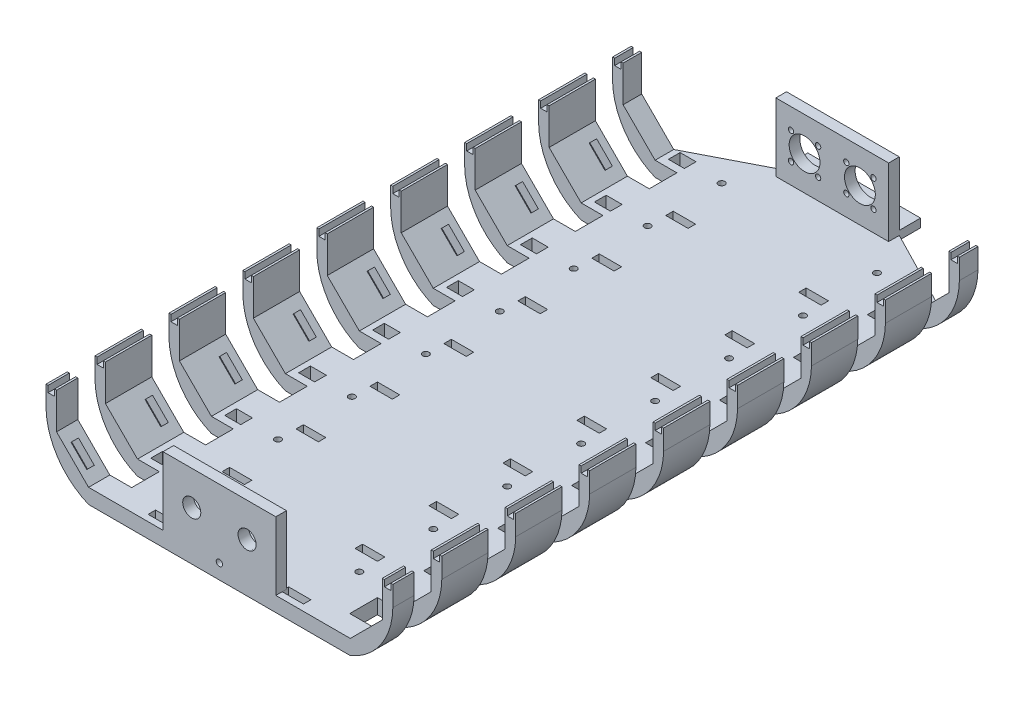
from build123d import *

# Parameters (mm, degrees)
BOSS_EXTRUDE1_DEPTH      = 7
SKETCH2_W                = 123
SKETCH2_H                = 5
BOSS_EXTRUDE2_DEPTH      = 32
SKETCH9_W                = 123
SKETCH9_H                = 7
BOSS_EXTRUDE4_DEPTH      = 5
SKETCH13_W               = 35
SKETCH13_H               = 32
CUT_EXTRUDE5_DEPTH       = 11
BOSS_EXTRUDE10_DEPTH     = 275
BOSS_EXTRUDE13_DEPTH     = 7
SKETCH18_W               = 53
SKETCH18_H               = 5
BOSS_EXTRUDE14_DEPTH     = 32
SKETCH3_R                = 4.25
CUT_EXTRUDE8_DEPTH       = 334
SKETCH19_R               = 7.25
SKETCH19_R_2             = 1.25
CUT_EXTRUDE9_DEPTH       = 334
CUT_EXTRUDE13_DEPTH      = 19
CUT_EXTRUDE16_DEPTH      = 181.638451056
CUT_EXTRUDE16_DEPTH_BACK = 181.638451056
SKETCH32_R               = 1.5
SKETCH32_W               = 30.25
SKETCH32_H               = 13
SKETCH32_W_2             = 7.5
SKETCH32_H_2             = 5.5
SKETCH33_W               = 10.5
SKETCH33_H               = 3.5
CUT_EXTRUDE18_DEPTH      = 4.5
SKETCH34_W               = 3.5
SKETCH34_H               = 10.5
CUT_EXTRUDE19_DEPTH      = 4.5
SKETCH35_W               = 3
SKETCH35_H               = 275
CUT_EXTRUDE20_DEPTH      = 3
SKETCH36_W               = 53
SKETCH36_H               = 4
BOSS_EXTRUDE15_DEPTH     = 10
SKETCH37_R               = 1.5
CUT_EXTRUDE21_DEPTH      = 10
DRAFT1_ANGLE             = 1


with BuildPart() as part:
    # Sketch1 → Boss-Extrude1 (new body)
    with BuildSketch(Plane(origin=(0, 0, 0), x_dir=(1, 0, 0), z_dir=(0, 1, 0))):
        Polygon((-13, 135), (-36, 135), (-61.5, 135), (-61.5, -135), (-36, -135), (-13, -135), (13, -135), (36, -135), (61.5, -135), (61.5, 135), (36, 135), (13, 135), align=None)
    extrude(amount=BOSS_EXTRUDE1_DEPTH)

    # Sketch2 → Boss-Extrude2 (add)
    with BuildSketch(Plane(origin=(0, 7, 0), x_dir=(1, 0, 0), z_dir=(0, 1, 0))):
        with Locations((0, -132.5)):
            Rectangle(SKETCH2_W, SKETCH2_H)
    extrude(amount=BOSS_EXTRUDE2_DEPTH)

    # Sketch9 → Boss-Extrude4 (add)
    with BuildSketch(Plane(origin=(0, 0, -135), x_dir=(-1, 0, 0), z_dir=(0, 0, -1))):
        with Locations((0, 3.5)):
            Rectangle(SKETCH9_W, SKETCH9_H)
    extrude(amount=BOSS_EXTRUDE4_DEPTH)

    # Sketch13 → Cut-Extrude5 (cut)
    with BuildSketch(Plane.XY.offset(135)):
        with Locations((-44, 23)):
            Rectangle(SKETCH13_W, SKETCH13_H)
        with Locations((44, 23)):
            Rectangle(SKETCH13_W, SKETCH13_H)
    extrude(amount=-CUT_EXTRUDE5_DEPTH, mode=Mode.SUBTRACT)

    # Sketch14 → Boss-Extrude10 (add)
    with BuildSketch(Plane.XY.offset(135)):
        with BuildLine():
            Line((-76.55, 22.05), (-61.5, 7))
            Line((-61.5, 7), (-61.5, 0))
            ThreePointArc((-61.5, 0), (-75.904786932, 11.763703775), (-81.5, 29.5))
            Line((-81.5, 29.5), (-81.5, 39))
            Line((-81.5, 39), (-76.55, 39))
            Line((-76.55, 39), (-76.55, 22.05))
        make_face()
        with BuildLine():
            Line((81.5, 39), (76.55, 39))
            Line((76.55, 39), (76.55, 22.05))
            Line((76.55, 22.05), (61.5, 7))
            Line((61.5, 7), (61.5, 0))
            ThreePointArc((61.5, 0), (75.904786932, 11.763703775), (81.5, 29.5))
            Line((81.5, 29.5), (81.5, 39))
        make_face()
    extrude(amount=-BOSS_EXTRUDE10_DEPTH)

    # Sketch17 → Boss-Extrude13 (add)
    with BuildSketch(Plane(origin=(0, 7, 0), x_dir=(1, 0, 0), z_dir=(0, 1, 0))):
        Polygon((-61.5, 140), (-26.5, 226), (0, 226), (26.5, 226), (61.5, 140), align=None)
    extrude(amount=-BOSS_EXTRUDE13_DEPTH)

    # Sketch18 → Boss-Extrude14 (add)
    with BuildSketch(Plane(origin=(0, 7, 0), x_dir=(1, 0, 0), z_dir=(0, 1, 0))):
        with Locations((0, 155.5)):
            Rectangle(SKETCH18_W, SKETCH18_H)
    extrude(amount=BOSS_EXTRUDE14_DEPTH)

    # Sketch3 → Cut-Extrude8 (cut)
    with BuildSketch(Plane.XY.offset(135)):
        with Locations((-13, 23)):
            Circle(SKETCH3_R)
        with Locations((13, 23)):
            Circle(SKETCH3_R)
    extrude(amount=-CUT_EXTRUDE8_DEPTH, mode=Mode.SUBTRACT)

    # Sketch19 → Cut-Extrude9 (cut)
    with BuildSketch(Plane.XY.offset(-153)):
        with Locations((-13, 23)):
            Circle(SKETCH19_R)
        with Locations((-6.636038969, 16.636038969)):
            Circle(SKETCH19_R_2)
        with Locations((-6.636038969, 29.363961031)):
            Circle(SKETCH19_R_2)
        with Locations((-19.363961031, 29.363961031)):
            Circle(SKETCH19_R_2)
        with Locations((-19.363961031, 16.636038969)):
            Circle(SKETCH19_R_2)
        with Locations((13, 23)):
            Circle(SKETCH19_R)
        with Locations((19.363961031, 16.636038969)):
            Circle(SKETCH19_R_2)
        with Locations((6.636038969, 16.636038969)):
            Circle(SKETCH19_R_2)
        with Locations((6.636038969, 29.363961031)):
            Circle(SKETCH19_R_2)
        with Locations((19.363961031, 29.363961031)):
            Circle(SKETCH19_R_2)
    extrude(amount=-CUT_EXTRUDE9_DEPTH, mode=Mode.SUBTRACT)

    # Sketch29 → Cut-Extrude13 (cut)
    with BuildSketch(Plane(origin=(0, 7, 0), x_dir=(1, 0, 0), z_dir=(0, 1, 0))):
        Polygon((-61.5, 140), (-26.5, 158), (26.5, 158), (61.5, 140), (26.5, 226), (-26.5, 226), align=None)
    extrude(amount=-CUT_EXTRUDE13_DEPTH, mode=Mode.SUBTRACT)

    # Sketch32 → Cut-Extrude16 (cut, two sides: drawn at the far end of the back side and taken through both)
    with BuildSketch(Plane(origin=(0, 7, 0), x_dir=(1, 0, 0), z_dir=(0, 1, 0)).offset(-CUT_EXTRUDE16_DEPTH_BACK)):
        with Locations((-36.5, 137.5)):
            Circle(SKETCH32_R)
        with Locations((-36.5, 102.75)):
            Circle(SKETCH32_R)
        with Locations((-36.5, 68)):
            Circle(SKETCH32_R)
        with Locations((-36.5, 33.25)):
            Circle(SKETCH32_R)
        with Locations((-36.5, -1.5)):
            Circle(SKETCH32_R)
        with Locations((-36.5, -36.25)):
            Circle(SKETCH32_R)
        with Locations((-36.5, -71)):
            Circle(SKETCH32_R)
        with Locations((-36.5, -105.75)):
            Circle(SKETCH32_R)
        with Locations((36.5, -105.75)):
            Circle(SKETCH32_R)
        with Locations((36.5, -71)):
            Circle(SKETCH32_R)
        with Locations((36.5, -36.25)):
            Circle(SKETCH32_R)
        with Locations((36.5, -1.5)):
            Circle(SKETCH32_R)
        with Locations((36.5, 33.25)):
            Circle(SKETCH32_R)
        with Locations((36.5, 68)):
            Circle(SKETCH32_R)
        with Locations((36.5, 102.75)):
            Circle(SKETCH32_R)
        with Locations((36.5, 137.5)):
            Circle(SKETCH32_R)
        with Locations((-66.375, 124.75)):
            Rectangle(SKETCH32_W, SKETCH32_H)
        with Locations((-55, 137.5)):
            Rectangle(SKETCH32_W_2, SKETCH32_H_2)
        with Locations((-66.375, 90)):
            Rectangle(SKETCH32_W, SKETCH32_H)
        with Locations((-55, 102.75)):
            Rectangle(SKETCH32_W_2, SKETCH32_H_2)
        with Locations((-66.375, 55.25)):
            Rectangle(SKETCH32_W, SKETCH32_H)
        with Locations((-55, 68)):
            Rectangle(SKETCH32_W_2, SKETCH32_H_2)
        with Locations((-66.375, 20.5)):
            Rectangle(SKETCH32_W, SKETCH32_H)
        with Locations((-55, 33.25)):
            Rectangle(SKETCH32_W_2, SKETCH32_H_2)
        with Locations((-66.375, -14.25)):
            Rectangle(SKETCH32_W, SKETCH32_H)
        with Locations((-55, -1.5)):
            Rectangle(SKETCH32_W_2, SKETCH32_H_2)
        with Locations((-66.375, -49)):
            Rectangle(SKETCH32_W, SKETCH32_H)
        with Locations((-55, -36.25)):
            Rectangle(SKETCH32_W_2, SKETCH32_H_2)
        with Locations((-66.375, -83.75)):
            Rectangle(SKETCH32_W, SKETCH32_H)
        with Locations((-55, -71)):
            Rectangle(SKETCH32_W_2, SKETCH32_H_2)
        with Locations((-66.375, -118.5)):
            Rectangle(SKETCH32_W, SKETCH32_H)
        with Locations((-55, -105.75)):
            Rectangle(SKETCH32_W_2, SKETCH32_H_2)
        with Locations((55, -105.75)):
            Rectangle(SKETCH32_W_2, SKETCH32_H_2)
        with Locations((66.375, -118.5)):
            Rectangle(SKETCH32_W, SKETCH32_H)
        with Locations((55, -71)):
            Rectangle(SKETCH32_W_2, SKETCH32_H_2)
        with Locations((66.375, -83.75)):
            Rectangle(SKETCH32_W, SKETCH32_H)
        with Locations((55, -36.25)):
            Rectangle(SKETCH32_W_2, SKETCH32_H_2)
        with Locations((66.375, -49)):
            Rectangle(SKETCH32_W, SKETCH32_H)
        with Locations((55, -1.5)):
            Rectangle(SKETCH32_W_2, SKETCH32_H_2)
        with Locations((66.375, -14.25)):
            Rectangle(SKETCH32_W, SKETCH32_H)
        with Locations((55, 33.25)):
            Rectangle(SKETCH32_W_2, SKETCH32_H_2)
        with Locations((66.375, 20.5)):
            Rectangle(SKETCH32_W, SKETCH32_H)
        with Locations((55, 68)):
            Rectangle(SKETCH32_W_2, SKETCH32_H_2)
        with Locations((66.375, 55.25)):
            Rectangle(SKETCH32_W, SKETCH32_H)
        with Locations((55, 102.75)):
            Rectangle(SKETCH32_W_2, SKETCH32_H_2)
        with Locations((66.375, 90)):
            Rectangle(SKETCH32_W, SKETCH32_H)
        with Locations((66.375, 124.75)):
            Rectangle(SKETCH32_W, SKETCH32_H)
        with Locations((55, 137.5)):
            Rectangle(SKETCH32_W_2, SKETCH32_H_2)
    extrude(amount=CUT_EXTRUDE16_DEPTH + CUT_EXTRUDE16_DEPTH_BACK, mode=Mode.SUBTRACT)

    # Sketch33 → Cut-Extrude18 (cut)
    with BuildSketch(Plane(origin=(0, 7, 0), x_dir=(1, 0, 0), z_dir=(0, 1, 0))):
        with Locations((-31.25, 113)):
            Rectangle(SKETCH33_W, SKETCH33_H)
        with Locations((-31.25, 78.25)):
            Rectangle(SKETCH33_W, SKETCH33_H)
        with Locations((-31.25, 43.5)):
            Rectangle(SKETCH33_W, SKETCH33_H)
        with Locations((-31.25, 8.75)):
            Rectangle(SKETCH33_W, SKETCH33_H)
        with Locations((-31.25, -26)):
            Rectangle(SKETCH33_W, SKETCH33_H)
        with Locations((-31.25, -60.75)):
            Rectangle(SKETCH33_W, SKETCH33_H)
        with Locations((-31.25, -95.5)):
            Rectangle(SKETCH33_W, SKETCH33_H)
        with Locations((-31.25, -130.25)):
            Rectangle(SKETCH33_W, SKETCH33_H)
        with Locations((31.25, -130.25)):
            Rectangle(SKETCH33_W, SKETCH33_H)
        with Locations((31.25, -95.5)):
            Rectangle(SKETCH33_W, SKETCH33_H)
        with Locations((31.25, -60.75)):
            Rectangle(SKETCH33_W, SKETCH33_H)
        with Locations((31.25, -26)):
            Rectangle(SKETCH33_W, SKETCH33_H)
        with Locations((31.25, 8.75)):
            Rectangle(SKETCH33_W, SKETCH33_H)
        with Locations((31.25, 43.5)):
            Rectangle(SKETCH33_W, SKETCH33_H)
        with Locations((31.25, 78.25)):
            Rectangle(SKETCH33_W, SKETCH33_H)
        with Locations((31.25, 113)):
            Rectangle(SKETCH33_W, SKETCH33_H)
    extrude(amount=-CUT_EXTRUDE18_DEPTH, mode=Mode.SUBTRACT)

    # Sketch34 → Cut-Extrude19 (cut)
    with BuildSketch(Plane(origin=(27.25, -27.25, 0), x_dir=(0, 0, 1), z_dir=(-0.707106781186546, 0.707106781186549, 0))):
        with Locations((-78.464285714, 59.078771568)):
            Rectangle(SKETCH34_W, SKETCH34_H)
        with Locations((-113.25, 59.078771568)):
            Rectangle(SKETCH34_W, SKETCH34_H)
        with Locations((-43.678571429, 59.078771568)):
            Rectangle(SKETCH34_W, SKETCH34_H)
        with Locations((-8.892857143, 59.078771568)):
            Rectangle(SKETCH34_W, SKETCH34_H)
        with Locations((25.892857143, 59.078771568)):
            Rectangle(SKETCH34_W, SKETCH34_H)
        with Locations((60.678571429, 59.078771568)):
            Rectangle(SKETCH34_W, SKETCH34_H)
        with Locations((95.464285714, 59.078771568)):
            Rectangle(SKETCH34_W, SKETCH34_H)
        with Locations((130.25, 59.078771568)):
            Rectangle(SKETCH34_W, SKETCH34_H)
    cut_extrude19 = extrude(amount=-CUT_EXTRUDE19_DEPTH, mode=Mode.SUBTRACT)

    # Mirror1: Cut-Extrude19 across plane
    add(cut_extrude19.mirror(Plane(origin=(0, 0, 0), x_dir=(0, 0, 1), z_dir=(1, 0, 0))), mode=Mode.SUBTRACT)

    # Sketch35 → Cut-Extrude20 (cut)
    with BuildSketch(Plane(origin=(0, 39, 0), x_dir=(1, 0, 0), z_dir=(0, 1, 0))):
        with Locations((-79.025, 2.5)):
            Rectangle(SKETCH35_W, SKETCH35_H)
        with Locations((79.025, 2.5)):
            Rectangle(SKETCH35_W, SKETCH35_H)
    extrude(amount=-CUT_EXTRUDE20_DEPTH, mode=Mode.SUBTRACT)

    # Sketch36 → Boss-Extrude15 (add)
    with BuildSketch(Plane(origin=(0, 0, -158), x_dir=(-1, 0, 0), z_dir=(0, 0, -1))):
        with Locations((0, 7.085276911)):
            Rectangle(SKETCH36_W, SKETCH36_H)
    extrude(amount=BOSS_EXTRUDE15_DEPTH)

    # Sketch37 → Cut-Extrude21 (cut)
    with BuildSketch(Plane.XY.offset(135)):
        with Locations((0, 7)):
            Circle(SKETCH37_R)
    extrude(amount=-CUT_EXTRUDE21_DEPTH, mode=Mode.SUBTRACT)

    # Draft1
    draft1_faces = [part.faces().sort_by_distance(p)[0] for p in [
        (8.75, 23, 132.5),
        (-17.25, 23, 132.5),
    ]]
    draft(draft1_faces, Plane(origin=(61.5, 7, 135), x_dir=(1, 0, 0), z_dir=(0, 0, 1)), DRAFT1_ANGLE)


solid = part.part
